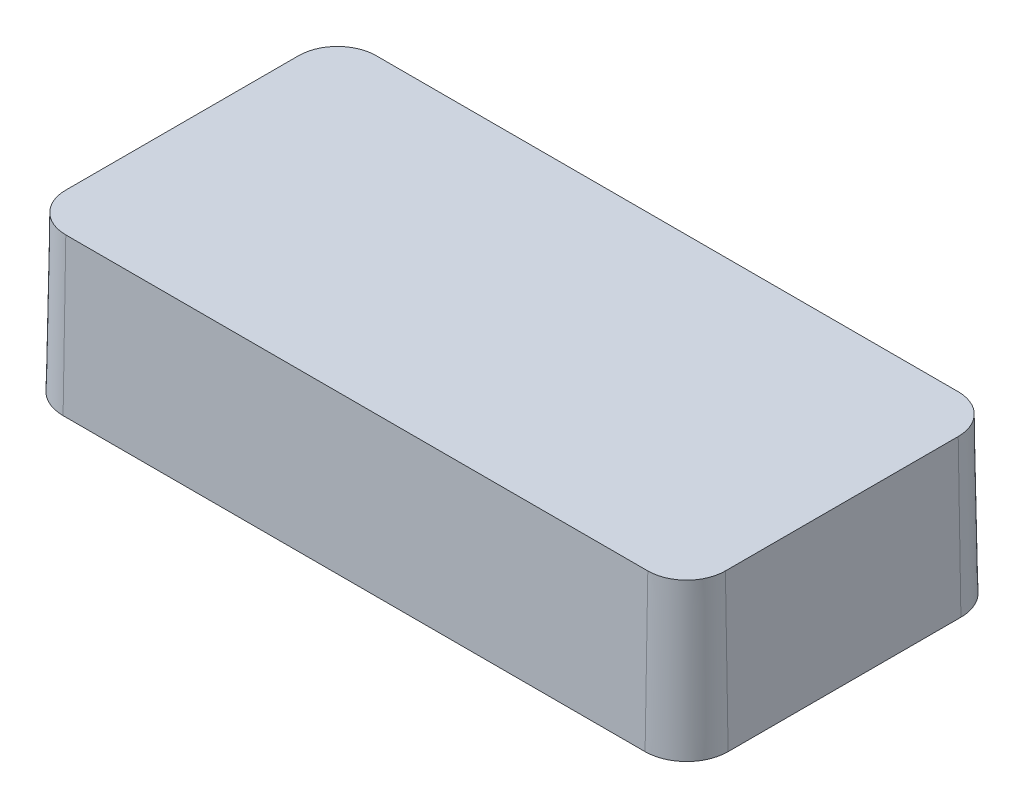
from build123d import *

# Parameters (mm, degrees)
BOSS_EXTRUDE1_DEPTH = 4
BOSS_EXTRUDE1_DRAFT = 1
SHELL1_T            = -0.5
SKETCH2_R           = 2
BOSS_EXTRUDE2_DEPTH = 5.5
BOSS_EXTRUDE2_TAPER = 1.5
CIRPATTERN1_COUNT   = 4


with BuildPart() as part:
    # Sketch1 → Boss-Extrude1 (with draft: the straight prism first)
    with BuildSketch(Plane(origin=(0, 0, 0), x_dir=(1, 0, 0), z_dir=(0, 1, 0))):
        with BuildLine():
            Line((-7.5, -4), (7.5, -4))
            ThreePointArc((7.5, -4), (8.207106781, -3.707106781), (8.5, -3))
            Line((8.5, -3), (8.5, 3))
            ThreePointArc((8.5, 3), (8.207106781, 3.707106781), (7.5, 4))
            Line((7.5, 4), (-7.5, 4))
            ThreePointArc((-7.5, 4), (-8.207106781, 3.707106781), (-8.5, 3))
            Line((-8.5, 3), (-8.5, -3))
            ThreePointArc((-8.5, -3), (-8.207106781, -3.707106781), (-7.5, -4))
        make_face()
    extrude(amount=-BOSS_EXTRUDE1_DEPTH)
    # Boss-Extrude1: the draft: its side faces are tilted about the plane it starts from
    boss_extrude1_sides = [part.faces().sort_by_distance(p)[0] for p in [
        (0, -2, 4),
        (8.207106781, -2, 3.707106781),
        (8.5, -2, 0),
        (8.207106781, -2, -3.707106781),
        (0, -2, -4),
        (-8.207106781, -2, -3.707106781),
        (-8.5, -2, 0),
        (-8.207106781, -2, 3.707106781),
    ]]
    draft(boss_extrude1_sides, Plane(origin=(0, 0, 0), x_dir=(1, 0, 0), z_dir=(0, 1, 0)), BOSS_EXTRUDE1_DRAFT)

    # Shell1
    shell1_openings = [part.faces().sort_by_distance(p)[0] for p in [
        (0, -4, 0),
    ]]
    offset(amount=SHELL1_T, openings=shell1_openings, kind=Kind.INTERSECTION)

    # Sketch2 → Boss-Extrude2 (add)
    with BuildSketch(Plane.XZ.offset(0.5)):
        Circle(SKETCH2_R)
    extrude(amount=BOSS_EXTRUDE2_DEPTH, taper=BOSS_EXTRUDE2_TAPER)

    # Rib1: read off the stored shape, not the designer's step
    # Rib1: loft between two sections, ruled curve by curve
    rib1_from = [
        Edge.make_line((1.982021382, -0.5, 0.267565397), (3, -0.5, 0.25)),
        Edge.make_line((1.982021382, -0.5, -0.267565397), (3, -0.5, -0.25)),
        Edge.make_line((3, -0.5, -0.25), (3, -0.5, 0.25)),
        Edge.make_line((1.982021382, -0.5, -0.267565397), (1.982021382, -0.5, 0.267565397)),
    ]
    rib1_to = [
        Edge.make_line((1.877498903, -4.5, 0.258832698), (2.38938588, -4.5, 0.25)),
        Edge.make_line((1.877498903, -4.5, -0.258832698), (2.38938588, -4.5, -0.25)),
        Edge.make_line((2.38938588, -4.5, -0.25), (2.38938588, -4.5, 0.25)),
        Edge.make_line((1.877498903, -4.5, -0.258832698), (1.877498903, -4.5, 0.258832698)),
    ]
    rib1 = Solid(Shell([*[Face.make_surface_from_curves(rib1_from[k], rib1_to[k]) for k in range(4)], Face(Wire(rib1_from)), Face(Wire(rib1_to))]))
    add(rib1)

    # CirPattern1: Rib1 ×4 about axis
    cirpattern1_axis = Axis((0, 0, 0), (0, 1, 0))
    for i in range(1, CIRPATTERN1_COUNT):
        add(rib1.rotate(cirpattern1_axis, i * 360 / CIRPATTERN1_COUNT))


solid = part.part
